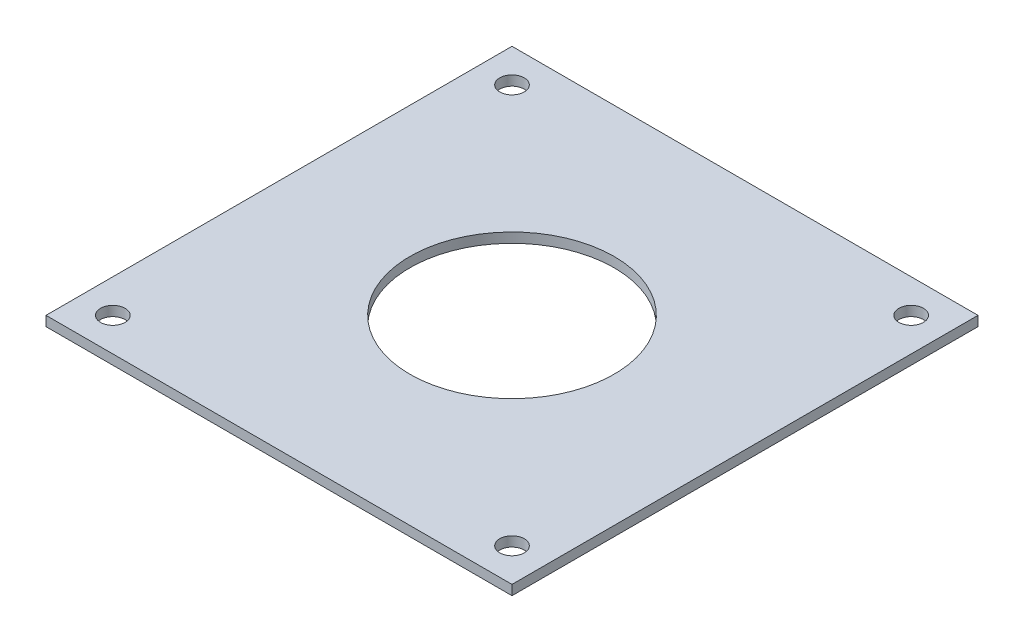
from build123d import *

# Parameters (mm, degrees)
SKETCH1_W          = 76
SKETCH1_H          = 76
SKETCH1_R          = 2
SKETCH1_R_2        = 16.65
BASE_FLANGE1_DEPTH = 1.6


# Sheet-metal steps are written as plain solids
with BuildPart() as part:
    # Sketch1 → Base-Flange1 (new body)
    with BuildSketch(Plane(origin=(0, 0, 0), x_dir=(1, 0, 0), z_dir=(0, 1, 0))):
        Rectangle(SKETCH1_W, SKETCH1_H)
        with Locations(Location((32.55, 32.55, 0), (0, 0, 270))):
            Circle(SKETCH1_R, mode=Mode.SUBTRACT)
        with Locations(Location((0, 0, 0), (0, 0, 270))):
            Circle(SKETCH1_R_2, mode=Mode.SUBTRACT)
        with Locations(Location((32.55, -32.55, 0), (0, 0, 270))):
            Circle(SKETCH1_R, mode=Mode.SUBTRACT)
        with Locations(Location((-32.55, -32.55, 0), (0, 0, 270))):
            Circle(SKETCH1_R, mode=Mode.SUBTRACT)
        with Locations(Location((-32.55, 32.55, 0), (0, 0, 270))):
            Circle(SKETCH1_R, mode=Mode.SUBTRACT)
    extrude(amount=-BASE_FLANGE1_DEPTH)


solid = part.part
